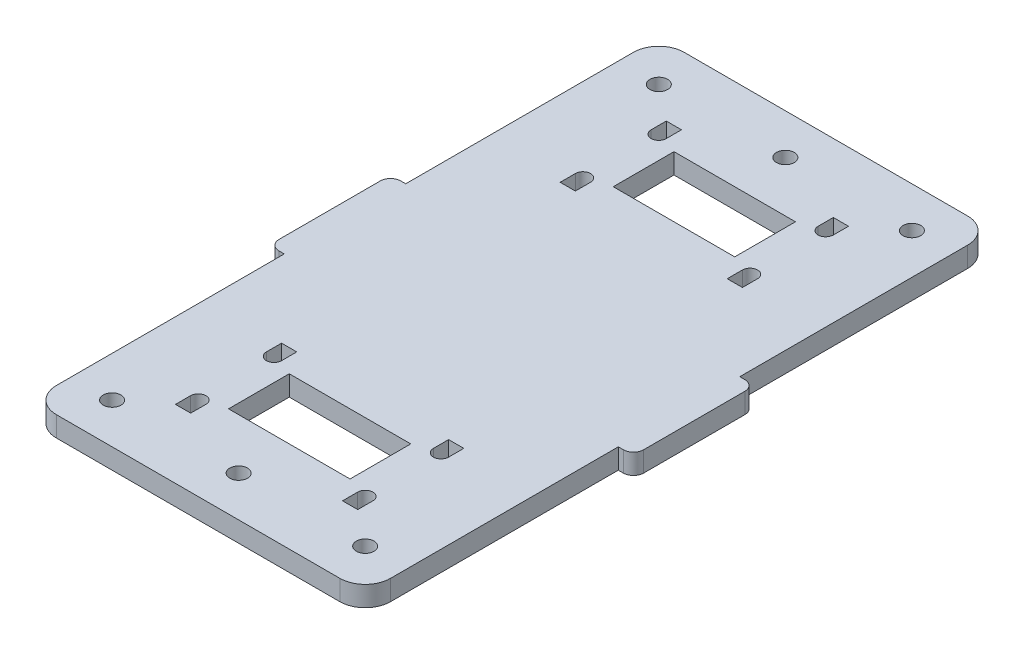
from build123d import *

# Parameters (mm, degrees)
SKETCH_1_W               = 72
SKETCH_1_H               = 100
EXTRUDE_1_DEPTH          = 4
SKETCH_2_W               = 72
SKETCH_2_H               = 4
EXTRUDE_2_DEPTH          = 24
CUT_EXTRUDE_1_DEPTH      = 83.389319696
CUT_EXTRUDE_1_DEPTH_BACK = 83.389319696
SKETCH_3_W               = 3
SKETCH_3_H               = 50
CUT_EXTRUDE_2_DEPTH      = 83.389319696
CUT_EXTRUDE_2_DEPTH_BACK = 83.389319696
SKETCH_5_R               = 1.75
CUT_EXTRUDE_3_DEPTH      = 83.389319696
CUT_EXTRUDE_3_DEPTH_BACK = 83.389319696
SKETCH_6_R               = 1.75
CUT_EXTRUDE_4_DEPTH      = 83.389319696
CUT_EXTRUDE_4_DEPTH_BACK = 83.389319696
SKETCH_7_W               = 24
SKETCH_7_H               = 12
FILLET_1_R               = 5
FILLET_2_R               = 2
CUT_EXTRUDE_5_DEPTH      = 83.389319696
CUT_EXTRUDE_5_DEPTH_BACK = 83.389319696
SKETCH_8_R               = 1.75
CUT_EXTRUDE_6_DEPTH      = 83.389319696
CUT_EXTRUDE_6_DEPTH_BACK = 83.389319696


with BuildPart() as part:
    # 草图1 → 凸台-拉伸1 (new body)
    with BuildSketch(Plane(origin=(0, 0, 0), x_dir=(1, 0, 0), z_dir=(0, 1, 0))):
        Rectangle(SKETCH_1_W, SKETCH_1_H)
    extrude(amount=EXTRUDE_1_DEPTH)

    # 草图2 → 凸台-拉伸2 (add)
    with BuildSketch(Plane.XY.offset(50)):
        with Locations((0, 2)):
            Rectangle(SKETCH_2_W, SKETCH_2_H)
    extrude(amount=EXTRUDE_2_DEPTH)

    # 草图3 → 切除-拉伸1 (cut, two sides: drawn at the far end of the back side and taken through both)
    with BuildSketch(Plane(origin=(0, 4, 0), x_dir=(1, 0, 0), z_dir=(0, 1, 0)).offset(-CUT_EXTRUDE_1_DEPTH_BACK)):
        with Locations((-34.5, 25)):
            Rectangle(SKETCH_3_W, SKETCH_3_H)
        with Locations((34.5, 25)):
            Rectangle(SKETCH_3_W, SKETCH_3_H)
        with Locations((-34.5, -49)):
            Rectangle(SKETCH_3_W, SKETCH_3_H)
        with Locations((34.5, -49)):
            Rectangle(SKETCH_3_W, SKETCH_3_H)
    extrude(amount=CUT_EXTRUDE_1_DEPTH + CUT_EXTRUDE_1_DEPTH_BACK, mode=Mode.SUBTRACT)

    # 草图5 → 切除-拉伸2 (cut, two sides: drawn at the far end of the back side and taken through both)
    with BuildSketch(Plane(origin=(0, 4, 0), x_dir=(1, 0, 0), z_dir=(0, 1, 0)).offset(-CUT_EXTRUDE_2_DEPTH_BACK)):
        with Locations((-25, 42)):
            Circle(SKETCH_5_R)
    extrude(amount=CUT_EXTRUDE_2_DEPTH + CUT_EXTRUDE_2_DEPTH_BACK, mode=Mode.SUBTRACT)

    # 草图6 → 切除-拉伸3 (cut, two sides: drawn at the far end of the back side and taken through both)
    with BuildSketch(Plane(origin=(0, 4, 0), x_dir=(1, 0, 0), z_dir=(0, 1, 0)).offset(-CUT_EXTRUDE_3_DEPTH_BACK)):
        with Locations((25, 42)):
            Circle(SKETCH_6_R)
        with Locations((-25, -66)):
            Circle(SKETCH_6_R)
        with Locations((25, -66)):
            Circle(SKETCH_6_R)
    extrude(amount=CUT_EXTRUDE_3_DEPTH + CUT_EXTRUDE_3_DEPTH_BACK, mode=Mode.SUBTRACT)

    # 草图7 → 切除-拉伸4 (cut, two sides: drawn at the far end of the back side and taken through both)
    with BuildSketch(Plane(origin=(0, 4, 0), x_dir=(1, 0, 0), z_dir=(0, 1, 0)).offset(-CUT_EXTRUDE_4_DEPTH_BACK)):
        with Locations((0, -50)):
            Rectangle(SKETCH_7_W, SKETCH_7_H)
        with Locations((0, 26)):
            Rectangle(SKETCH_7_W, SKETCH_7_H)
    extrude(amount=CUT_EXTRUDE_4_DEPTH + CUT_EXTRUDE_4_DEPTH_BACK, mode=Mode.SUBTRACT)

    # 圆角1
    fillet_1_edges = [part.edges().sort_by_distance(p)[0] for p in [
        (-33, 2, 74),
        (33, 2, 74),
        (33, 2, -50),
        (-33, 2, -50),
    ]]
    fillet(fillet_1_edges, radius=FILLET_1_R)

    # 圆角2
    fillet_2_edges = [part.edges().sort_by_distance(p)[0] for p in [
        (36, 2, 24),
        (36, 2, 0),
        (-36, 2, 24),
        (-36, 2, 0),
    ]]
    fillet(fillet_2_edges, radius=FILLET_2_R)

    # 草图8 → 切除-拉伸5 (cut, two sides: drawn at the far end of the back side and taken through both)
    with BuildSketch(Plane(origin=(0, 4, 0), x_dir=(1, 0, 0), z_dir=(0, 1, 0)).offset(-CUT_EXTRUDE_5_DEPTH_BACK)):
        with Locations((0, 42)):
            Circle(SKETCH_8_R)
        with Locations((0, -66)):
            Circle(SKETCH_8_R)
    extrude(amount=CUT_EXTRUDE_5_DEPTH + CUT_EXTRUDE_5_DEPTH_BACK, mode=Mode.SUBTRACT)

    # 草图9 → 切除-拉伸6 (cut, two sides: drawn at the far end of the back side and taken through both)
    with BuildSketch(Plane(origin=(0, 4, 0), x_dir=(1, 0, 0), z_dir=(0, 1, 0)).offset(-CUT_EXTRUDE_6_DEPTH_BACK)):
        with BuildLine():
            Line((15, 33.477548097), (15, 36.477548097))
            Line((15, 36.477548097), (18, 36.477548097))
            Line((18, 36.477548097), (18, 33.477548097))
            ThreePointArc((18, 33.477548097), (16.5, 31.977548097), (15, 33.477548097))
        make_face()
        with BuildLine():
            Line((-18, 36.477548097), (-18, 33.477548097))
            ThreePointArc((-18, 33.477548097), (-16.5, 31.977548097), (-15, 33.477548097))
            Line((-15, 33.477548097), (-15, 36.477548097))
            Line((-15, 36.477548097), (-18, 36.477548097))
        make_face()
        with BuildLine():
            Line((-15, -57.477548097), (-15, -60.477548097))
            Line((-15, -60.477548097), (-18, -60.477548097))
            Line((-18, -60.477548097), (-18, -57.477548097))
            ThreePointArc((-18, -57.477548097), (-16.5, -55.977548097), (-15, -57.477548097))
        make_face()
        with BuildLine():
            Line((18, -60.477548097), (18, -57.477548097))
            ThreePointArc((18, -57.477548097), (16.5, -55.977548097), (15, -57.477548097))
            Line((15, -57.477548097), (15, -60.477548097))
            Line((15, -60.477548097), (18, -60.477548097))
        make_face()
        with BuildLine():
            Line((-15, 18.517447437), (-15, 15.517447437))
            Line((-15, 15.517447437), (-18, 15.517447437))
            Line((-18, 15.517447437), (-18, 18.517447437))
            ThreePointArc((-18, 18.517447437), (-16.5, 20.017447437), (-15, 18.517447437))
        make_face()
        with BuildLine():
            Line((18, 15.517447437), (18, 18.517447437))
            ThreePointArc((18, 18.517447437), (16.5, 20.017447437), (15, 18.517447437))
            Line((15, 18.517447437), (15, 15.517447437))
            Line((15, 15.517447437), (18, 15.517447437))
        make_face()
        with BuildLine():
            Line((15, -42.522451903), (15, -39.522451903))
            Line((15, -39.522451903), (18, -39.522451903))
            Line((18, -39.522451903), (18, -42.522451903))
            ThreePointArc((18, -42.522451903), (16.5, -44.022451903), (15, -42.522451903))
        make_face()
        with BuildLine():
            Line((-18, -39.522451903), (-18, -42.522451903))
            ThreePointArc((-18, -42.522451903), (-16.5, -44.022451903), (-15, -42.522451903))
            Line((-15, -42.522451903), (-15, -39.522451903))
            Line((-15, -39.522451903), (-18, -39.522451903))
        make_face()
    extrude(amount=CUT_EXTRUDE_6_DEPTH + CUT_EXTRUDE_6_DEPTH_BACK, mode=Mode.SUBTRACT)


solid = part.part
